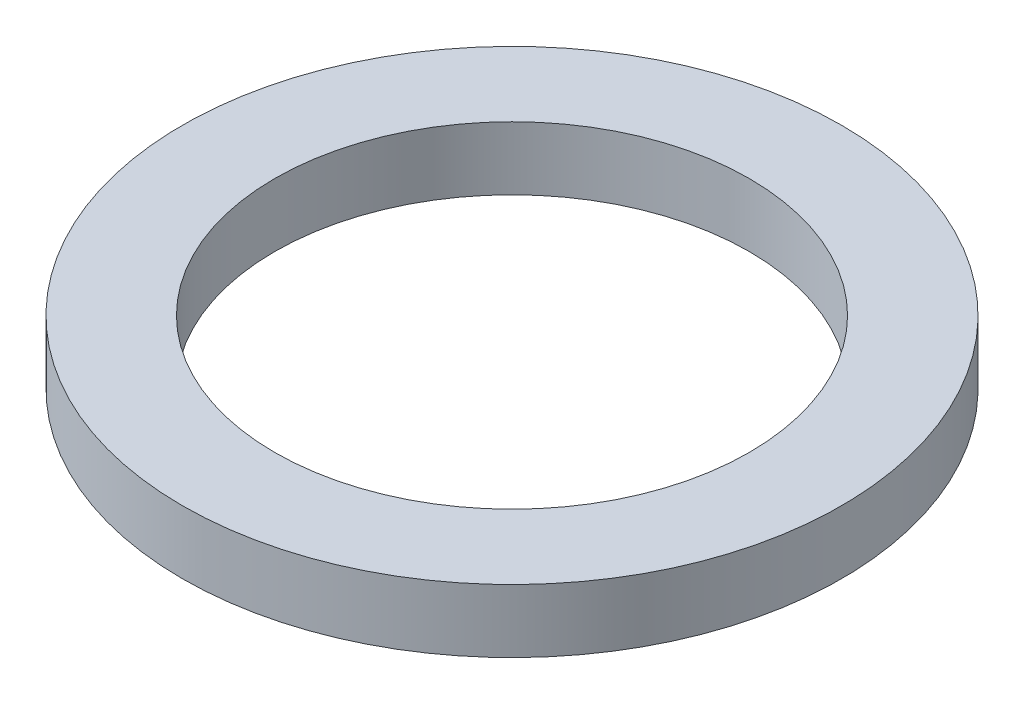
from build123d import *

# Parameters (mm, degrees)
SKETCH1_R           = 62.5
BOSS_EXTRUDE1_DEPTH = 12
SKETCH2_R           = 45
CUT_EXTRUDE1_DEPTH  = 90.199215243


with BuildPart() as part:
    # Sketch1 → Boss-Extrude1 (new body)
    with BuildSketch(Plane(origin=(0, 0, 0), x_dir=(1, 0, 0), z_dir=(0, 1, 0))):
        Circle(SKETCH1_R)
    extrude(amount=BOSS_EXTRUDE1_DEPTH)

    # Sketch2 → Cut-Extrude1 (cut, through all)
    with BuildSketch(Plane(origin=(0, 0, 0), x_dir=(1, 0, 0), z_dir=(0, 1, 0))):
        Circle(SKETCH2_R)
    extrude(amount=CUT_EXTRUDE1_DEPTH, mode=Mode.SUBTRACT)


solid = part.part
